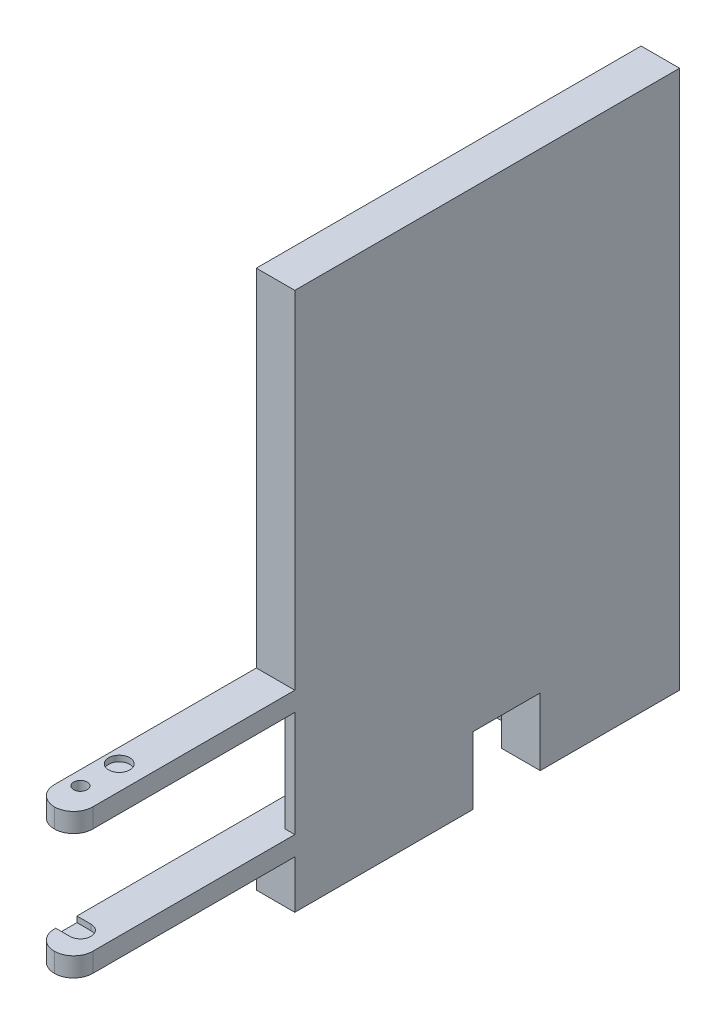
from build123d import *

# Parameters (mm, degrees)
SKETCH_1_W          = 20
SKETCH_1_H          = 280
EXTRUDE_1_DEPTH     = 200
SKETCH_2_W          = 35
SKETCH_2_H          = 35
CUT_EXTRUDE_1_DEPTH = 245.948974278
SKETCH_4_W          = 35
SKETCH_4_H          = 10
EXTRUDE_2_DEPTH     = 150
SKETCH_5_W          = 35
SKETCH_5_H          = 55
CUT_EXTRUDE_3_DEPTH = 24
CUT_EXTRUDE_4_REACH = 250.244
SKETCH_6_W          = 15
SKETCH_6_H          = 55
CUT_EXTRUDE_START   = -3
CUT_EXTRUDE_5_DEPTH = 61
SKETCH_9_W          = 20
SKETCH_9_H          = 10
EXTRUDE_3_DEPTH     = 115
SKETCH_10_R         = 3.5
CUT_EXTRUDE_7_DEPTH = 20
SKETCH_11_R         = 5.5
CUT_EXTRUDE_8_DEPTH = 3
FILLET_1_R          = 10


with BuildPart() as part:
    # 草图1 → 凸台-拉伸1 (new body)
    with BuildSketch(Plane.XY):
        Rectangle(SKETCH_1_W, SKETCH_1_H)
    extrude(amount=EXTRUDE_1_DEPTH)

    # 草图2 → 切除-拉伸1 (cut, through all)
    with BuildSketch(Plane.ZY.offset(10)):
        with Locations((89.937894672, -122.5)):
            Rectangle(SKETCH_2_W, SKETCH_2_H)
    extrude(amount=-CUT_EXTRUDE_1_DEPTH, mode=Mode.SUBTRACT)

    # 草图4 → 凸台-拉伸2 (add)
    with BuildSketch(Plane.XZ.offset(140)):
        with Locations((-27.5, 54.987894672)):
            Rectangle(SKETCH_4_W, SKETCH_4_H)
        with Locations((-27.5, 139.987894672)):
            Rectangle(SKETCH_4_W, SKETCH_4_H)
    extrude(amount=-EXTRUDE_2_DEPTH)

    # 草图5 → 切除-拉伸3 (cut)
    with BuildSketch(Plane.XY.offset(144.987894672)):
        with Locations((-27.5, -77.5)):
            Rectangle(SKETCH_5_W, SKETCH_5_H)
    extrude(amount=-CUT_EXTRUDE_3_DEPTH, mode=Mode.SUBTRACT)

    # 切除-拉伸4: up to this face of the body (flat: up to its plane)
    cut_extrude_4_end = Plane(part.part.faces().sort_by_distance((-27.5, -65, 59.987894672))[0])
    # 草图6 → 切除-拉伸4 (cut, up to the picked face)
    with BuildSketch(Plane.XY.offset(200), mode=Mode.PRIVATE) as cut_extrude_4_sk1:
        with Locations((-2.5, -77.5)):
            Rectangle(SKETCH_6_W, SKETCH_6_H)
    cut_extrude_4_tool1 = split(extrude(cut_extrude_4_sk1.sketch, amount=-CUT_EXTRUDE_4_REACH, mode=Mode.PRIVATE), bisect_by=cut_extrude_4_end, keep=Keep.BOTH, mode=Mode.PRIVATE)
    add(cut_extrude_4_tool1.solids().sort_by(Axis((-2.5, -77.5, 200), (0, 0, -1)))[0], mode=Mode.SUBTRACT)

    # 草图7 → 切除-拉伸5 (cut)
    with BuildSketch(Plane(origin=(0, -105, 0), x_dir=(1, 0, 0), z_dir=(0, 1, 0)).offset(CUT_EXTRUDE_START)):
        with BuildLine():
            Line((-2.661336035, -71.712894672), (-10, -71.712894672))
            Line((-10, -71.712894672), (-10, -60.712894672))
            Line((-10, -60.712894672), (-2.661336035, -60.712894672))
            ThreePointArc((-2.661336035, -60.712894672), (2.838663965, -66.212894672), (-2.661336035, -71.712894672))
        make_face()
    cut_extrude_5 = extrude(amount=CUT_EXTRUDE_5_DEPTH, mode=Mode.SUBTRACT)

    # 草图9 → 凸台-拉伸3 (add)
    with BuildSketch(Plane.XY.offset(200)):
        with Locations((0, -110)):
            Rectangle(SKETCH_9_W, SKETCH_9_H)
        with Locations((0, -45)):
            Rectangle(SKETCH_9_W, SKETCH_9_H)
    extrude(amount=EXTRUDE_3_DEPTH)

    # 镜向1: 切除-拉伸5 across plane
    add(cut_extrude_5.mirror(Plane(origin=(0, 0, 182.493947336), x_dir=(1, 0, 0), z_dir=(0, 0, -1))), mode=Mode.SUBTRACT)

    # 草图10 → 切除-拉伸7 (cut)
    with BuildSketch(Plane(origin=(0, -40, 0), x_dir=(1, 0, 0), z_dir=(0, 1, 0))):
        with Locations(Location((-2.661336035, -298.775, 0), (0, 0, 270))):
            Circle(SKETCH_10_R)
    extrude(amount=-CUT_EXTRUDE_7_DEPTH, mode=Mode.SUBTRACT)

    # 草图11 → 切除-拉伸8 (cut)
    with BuildSketch(Plane(origin=(0, -40, 0), x_dir=(1, 0, 0), z_dir=(0, 1, 0))):
        with Locations(Location((-2.5, -278.775, 0), (0, 0, 270))):
            Circle(SKETCH_11_R)
    extrude(amount=-CUT_EXTRUDE_8_DEPTH, mode=Mode.SUBTRACT)

    # 圆角1
    fillet_1_edges = [part.edges().sort_by_distance(p)[0] for p in [
        (10, -45, 315),
        (10, -110, 315),
        (-10, -45, 315),
        (-10, -110, 315),
    ]]
    fillet(fillet_1_edges, radius=FILLET_1_R - 0.0001)  # a hair under: the kernel refuses the full size


solid = part.part
